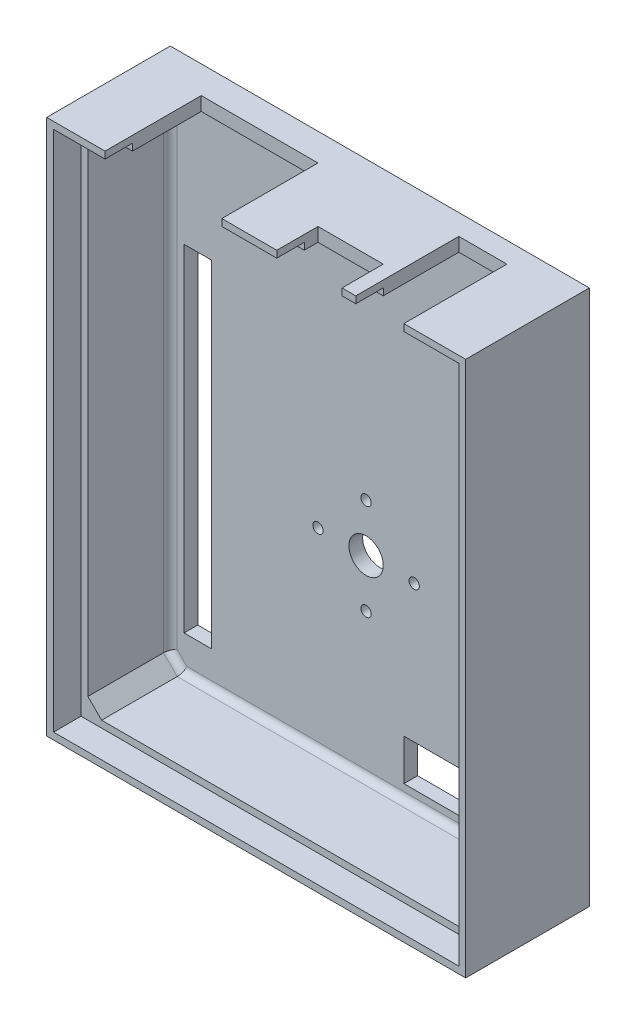
from build123d import *

# Parameters (mm, degrees)
ESQUISSE1_W             = 61
ESQUISSE1_H             = 78
BOSS_EXTRU_1_DEPTH      = 2
ESQUISSE2_W             = 61
ESQUISSE2_H             = 78
ESQUISSE2_W_2           = 57
ESQUISSE2_H_2           = 74
BOSS_EXTRU_2_DEPTH      = 12
ESQUISSE3_W             = 61
ESQUISSE3_H             = 78
ESQUISSE3_W_2           = 59
ESQUISSE3_H_2           = 76
BOSS_EXTRU_3_DEPTH      = 4
ESQUISSE7_W             = 17
ESQUISSE7_H             = 20.984875374
ESQUISSE7_W_2           = 7
ESQUISSE7_H_2           = 18.09159362
ESQUISSE7_W_3           = 9.5
ESQUISSE7_H_3           = 11.016430182
ENL_V_MAT_EXTRU_2_DEPTH = 3
ENL_V_MAT_EXTRU_3_REACH = 54.681
ESQUISSE8_W             = 4
ESQUISSE8_H             = 39
ESQUISSE8_H_2           = 49
ESQUISSE8_W_2           = 11
ESQUISSE8_H_3           = 6
CHANFREIN1_SIZE         = 2
ENL_V_MAT_EXTRU_4_REACH = 54.681
ESQUISSE9_R             = 2.5
ESQUISSE9_R_2           = 0.75
CONG_1_R                = 1


with BuildPart() as part:
    # Esquisse1 → Boss.-Extru.1 (new body)
    with BuildSketch(Plane.XY):
        Rectangle(ESQUISSE1_W, ESQUISSE1_H)
    extrude(amount=BOSS_EXTRU_1_DEPTH)

    # Esquisse2 → Boss.-Extru.2 (add)
    with BuildSketch(Plane.XY.offset(2)):
        Rectangle(ESQUISSE2_W, ESQUISSE2_H)
        Rectangle(ESQUISSE2_W_2, ESQUISSE2_H_2, mode=Mode.SUBTRACT)
    extrude(amount=BOSS_EXTRU_2_DEPTH)

    # Esquisse3 → Boss.-Extru.3 (add)
    with BuildSketch(Plane.XY.offset(14)):
        Rectangle(ESQUISSE3_W, ESQUISSE3_H)
        Rectangle(ESQUISSE3_W_2, ESQUISSE3_H_2, mode=Mode.SUBTRACT)
    extrude(amount=BOSS_EXTRU_3_DEPTH)

    # Esquisse7 → Enlèv. mat.-Extru.2 (cut)
    with BuildSketch(Plane(origin=(0, 39, 0), x_dir=(1, 0, 0), z_dir=(0, 1, 0))):
        with Locations((-13.5, -14.492437687)):
            Rectangle(ESQUISSE7_W, ESQUISSE7_H)
        with Locations((18, -12.04579681)):
            Rectangle(ESQUISSE7_W_2, ESQUISSE7_H_2)
        with Locations((7.75, -17.508215091)):
            Rectangle(ESQUISSE7_W_3, ESQUISSE7_H_3)
    extrude(amount=-ENL_V_MAT_EXTRU_2_DEPTH, mode=Mode.SUBTRACT)

    # Esquisse8 → Enlèv. mat.-Extru.3 (cut, up to next)
    with BuildSketch(Plane(origin=(0, 0, 0), x_dir=(-1, 0, 0), z_dir=(0, 0, -1)), mode=Mode.PRIVATE) as enl_v_mat_extru_3_sk1:
        with Locations((-24.5, -12.5)):
            Rectangle(ESQUISSE8_W, ESQUISSE8_H)
    enl_v_mat_extru_3_tool1 = extrude(enl_v_mat_extru_3_sk1.sketch, amount=-ENL_V_MAT_EXTRU_3_REACH, mode=Mode.PRIVATE) & part.part
    # Esquisse8 → Enlèv. mat.-Extru.3 (cut, up to next)
    with BuildSketch(Plane(origin=(0, 0, 0), x_dir=(-1, 0, 0), z_dir=(0, 0, -1)), mode=Mode.PRIVATE) as enl_v_mat_extru_3_sk2:
        with Locations((24.5, -7.5)):
            Rectangle(ESQUISSE8_W, ESQUISSE8_H_2)
    enl_v_mat_extru_3_tool2 = extrude(enl_v_mat_extru_3_sk2.sketch, amount=-ENL_V_MAT_EXTRU_3_REACH, mode=Mode.PRIVATE) & part.part
    # Esquisse8 → Enlèv. mat.-Extru.3 (cut, up to next)
    with BuildSketch(Plane(origin=(0, 0, 0), x_dir=(-1, 0, 0), z_dir=(0, 0, -1)), mode=Mode.PRIVATE) as enl_v_mat_extru_3_sk3:
        with Locations((-11, -32)):
            Rectangle(ESQUISSE8_W_2, ESQUISSE8_H_3)
    enl_v_mat_extru_3_tool3 = extrude(enl_v_mat_extru_3_sk3.sketch, amount=-ENL_V_MAT_EXTRU_3_REACH, mode=Mode.PRIVATE) & part.part
    add(enl_v_mat_extru_3_tool1.solids().sort_by_distance((24.5, -12.5, 0))[0], mode=Mode.SUBTRACT)
    add(enl_v_mat_extru_3_tool2.solids().sort_by_distance((-24.5, -7.5, 0))[0], mode=Mode.SUBTRACT)
    add(enl_v_mat_extru_3_tool3.solids().sort_by_distance((11, -32, 0))[0], mode=Mode.SUBTRACT)

    # Chanfrein1
    chanfrein1_edges = [part.edges().sort_by_distance(p)[0] for p in [
        (-28.5, -37, 8),
        (28.5, -37, 8),
        (28.5, 37, 8),
        (-28.5, 37, 8),
    ]]
    chamfer(chanfrein1_edges, length=CHANFREIN1_SIZE)

    # Esquisse9 → Enlèv. mat.-Extru.4 (cut, up to next)
    with BuildSketch(Plane(origin=(0, 0, 0), x_dir=(-1, 0, 0), z_dir=(0, 0, -1)), mode=Mode.PRIVATE) as enl_v_mat_extru_4_sk1:
        with Locations((0, -9)):
            Circle(ESQUISSE9_R)
    enl_v_mat_extru_4_tool1 = extrude(enl_v_mat_extru_4_sk1.sketch, amount=-ENL_V_MAT_EXTRU_4_REACH, mode=Mode.PRIVATE) & part.part
    # Esquisse9 → Enlèv. mat.-Extru.4 (cut, up to next)
    with BuildSketch(Plane(origin=(0, 0, 0), x_dir=(-1, 0, 0), z_dir=(0, 0, -1)), mode=Mode.PRIVATE) as enl_v_mat_extru_4_sk2:
        with Locations((-7, -9)):
            Circle(ESQUISSE9_R_2)
    enl_v_mat_extru_4_tool2 = extrude(enl_v_mat_extru_4_sk2.sketch, amount=-ENL_V_MAT_EXTRU_4_REACH, mode=Mode.PRIVATE) & part.part
    # Esquisse9 → Enlèv. mat.-Extru.4 (cut, up to next)
    with BuildSketch(Plane(origin=(0, 0, 0), x_dir=(-1, 0, 0), z_dir=(0, 0, -1)), mode=Mode.PRIVATE) as enl_v_mat_extru_4_sk3:
        with Locations((7, -9)):
            Circle(ESQUISSE9_R_2)
    enl_v_mat_extru_4_tool3 = extrude(enl_v_mat_extru_4_sk3.sketch, amount=-ENL_V_MAT_EXTRU_4_REACH, mode=Mode.PRIVATE) & part.part
    # Esquisse9 → Enlèv. mat.-Extru.4 (cut, up to next)
    with BuildSketch(Plane(origin=(0, 0, 0), x_dir=(-1, 0, 0), z_dir=(0, 0, -1)), mode=Mode.PRIVATE) as enl_v_mat_extru_4_sk4:
        with Locations((0, -2)):
            Circle(ESQUISSE9_R_2)
    enl_v_mat_extru_4_tool4 = extrude(enl_v_mat_extru_4_sk4.sketch, amount=-ENL_V_MAT_EXTRU_4_REACH, mode=Mode.PRIVATE) & part.part
    # Esquisse9 → Enlèv. mat.-Extru.4 (cut, up to next)
    with BuildSketch(Plane(origin=(0, 0, 0), x_dir=(-1, 0, 0), z_dir=(0, 0, -1)), mode=Mode.PRIVATE) as enl_v_mat_extru_4_sk5:
        with Locations((0, -16)):
            Circle(ESQUISSE9_R_2)
    enl_v_mat_extru_4_tool5 = extrude(enl_v_mat_extru_4_sk5.sketch, amount=-ENL_V_MAT_EXTRU_4_REACH, mode=Mode.PRIVATE) & part.part
    add(enl_v_mat_extru_4_tool1.solids().sort_by_distance((0, -9, 0))[0], mode=Mode.SUBTRACT)
    add(enl_v_mat_extru_4_tool2.solids().sort_by_distance((7, -9, 0))[0], mode=Mode.SUBTRACT)
    add(enl_v_mat_extru_4_tool3.solids().sort_by_distance((-7, -9, 0))[0], mode=Mode.SUBTRACT)
    add(enl_v_mat_extru_4_tool4.solids().sort_by_distance((0, -2, 0))[0], mode=Mode.SUBTRACT)
    add(enl_v_mat_extru_4_tool5.solids().sort_by_distance((0, -16, 0))[0], mode=Mode.SUBTRACT)

    # Congé1
    cong_1_edges = [part.edges().sort_by_distance(p)[0] for p in [
        (0, 37, 2),
        (-28.5, 0, 2),
        (0, -37, 2),
        (28.5, 0, 2),
        (27.5, 36, 2),
        (27.5, -36, 2),
        (-27.5, -36, 2),
        (-27.5, 36, 2),
    ]]
    fillet(cong_1_edges, radius=CONG_1_R - 0.0001)  # a hair under: the kernel refuses the full size


solid = part.part
